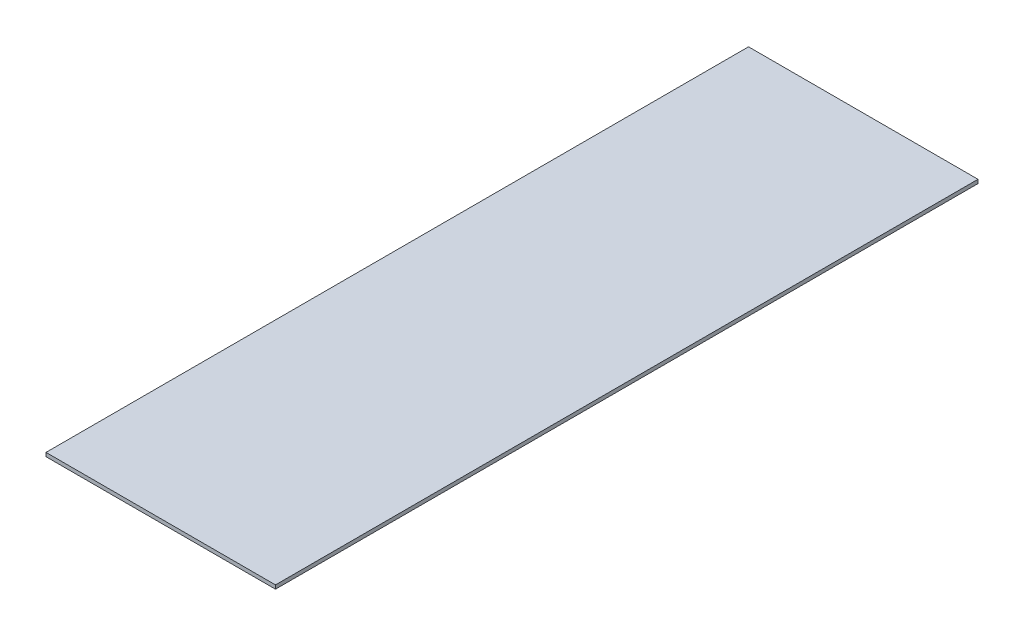
from build123d import *

# Parameters (mm, degrees)
ESQUISSE1_W        = 980
ESQUISSE1_H        = 3000
BOSS_EXTRU_1_DEPTH = 16


with BuildPart() as part:
    # Esquisse1 → Boss.-Extru.1 (new body)
    with BuildSketch(Plane(origin=(0, 0, 0), x_dir=(1, 0, 0), z_dir=(0, 1, 0))):
        with Locations((490, 1500)):
            Rectangle(ESQUISSE1_W, ESQUISSE1_H)
    extrude(amount=BOSS_EXTRU_1_DEPTH)


solid = part.part
